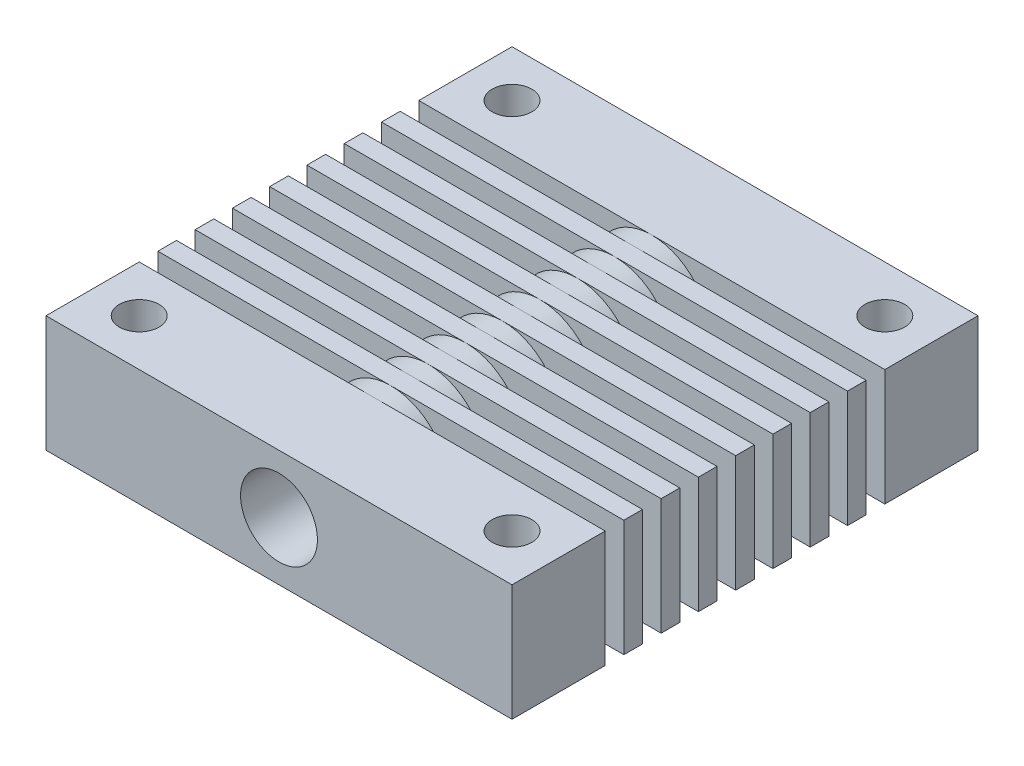
from build123d import *

# Parameters (mm, degrees)
ESQUISSE2_W                       = 40
ESQUISSE2_H                       = 10
BOSS_EXTRU_1_DEPTH                = 40
DIAM_TRE_DU_PER_AGE_4_1_4_1_1_D   = 4.1
D_GAGEMENT_M61_D                  = 6.6
D_GAGEMENT_M61_DEPTH              = 8
D_GAGEMENT_M61_TIP                = 1.982840043
DIAM_TRE_DU_PER_AGE_6_0_6_1_D     = 6.1
DIAM_TRE_DU_PER_AGE_6_0_6_1_DEPTH = 20
D_GAGEMENT_M31_D                  = 3.4
D_GAGEMENT_M32_D                  = 3.4
D_GAGEMENT_M32_DEPTH              = 5
ENL_V_START                       = 8
ESQUISSE20_R                      = 26.193290648
ESQUISSE20_R_2                    = 5
ENL_V_MAT_EXTRU_1_DEPTH           = 1.6
R_P_TITION_LIN_AIRE1_COUNT        = 8
R_P_TITION_LIN_AIRE1_PITCH        = 3.2


with BuildPart() as part:
    # Esquisse2 → Boss.-Extru.1 (new body)
    with BuildSketch(Plane.XY):
        with Locations((20, 5)):
            Rectangle(ESQUISSE2_W, ESQUISSE2_H)
    extrude(amount=BOSS_EXTRU_1_DEPTH)

    # Diamètre du perçage Ø4.1 (4.1)1 (through all)
    with Locations(Plane.XY.offset(40)):
        with Locations((20, 5)):
            Hole(DIAM_TRE_DU_PER_AGE_4_1_4_1_1_D / 2)

    # Dégagement M61
    with Locations(Plane.XY.offset(40)):
        with Locations((20, 5)):
            Hole(D_GAGEMENT_M61_D / 2, depth=D_GAGEMENT_M61_DEPTH)
            with Locations((0, 0, -(D_GAGEMENT_M61_DEPTH + D_GAGEMENT_M61_TIP / 2))):  # 118° drill point
                Cone(0, D_GAGEMENT_M61_D / 2, D_GAGEMENT_M61_TIP, mode=Mode.SUBTRACT)

    # Diamètre du perçage Ø6.0 (6)1
    with Locations(Plane(origin=(0, 0, 0), x_dir=(-1, 0, 0), z_dir=(0, 0, -1))):
        with Locations((-20, 5)):
            Hole(DIAM_TRE_DU_PER_AGE_6_0_6_1_D / 2, depth=DIAM_TRE_DU_PER_AGE_6_0_6_1_DEPTH)

    # Dégagement M31 (through all)
    with Locations(Plane(origin=(0, 0, 0), x_dir=(-1, 0, 0), z_dir=(0, -1, 0))):
        with Locations((-4, -36), (-36, -36), (-36, -4), (-4, -4)):
            Hole(D_GAGEMENT_M31_D / 2)

    # Dégagement M32
    with Locations(Plane(origin=(0, 0, 0), x_dir=(-1, 0, 0), z_dir=(0, -1, 0))):
        with Locations((-20, -4)):
            Hole(D_GAGEMENT_M32_D / 2, depth=D_GAGEMENT_M32_DEPTH)

    # Esquisse20 → Enlèv. mat.-Extru.1 (cut)
    with BuildSketch(Plane(origin=(0, 40, 40), x_dir=(-1, 0, 0), z_dir=(0, 0, -1)).offset(ENL_V_START)):
        with Locations((-20, -35)):
            Circle(ESQUISSE20_R)
        with Locations((-20, -35)):
            Circle(ESQUISSE20_R_2, mode=Mode.SUBTRACT)
    enl_v_mat_extru_1 = extrude(amount=ENL_V_MAT_EXTRU_1_DEPTH, mode=Mode.SUBTRACT)

    # Répétition linéaire1: Enlèv. mat.-Extru.1 ×8
    with Locations(*[(0, 0, -i * R_P_TITION_LIN_AIRE1_PITCH) for i in range(1, R_P_TITION_LIN_AIRE1_COUNT)]):
        add(enl_v_mat_extru_1, mode=Mode.SUBTRACT)


solid = part.part
